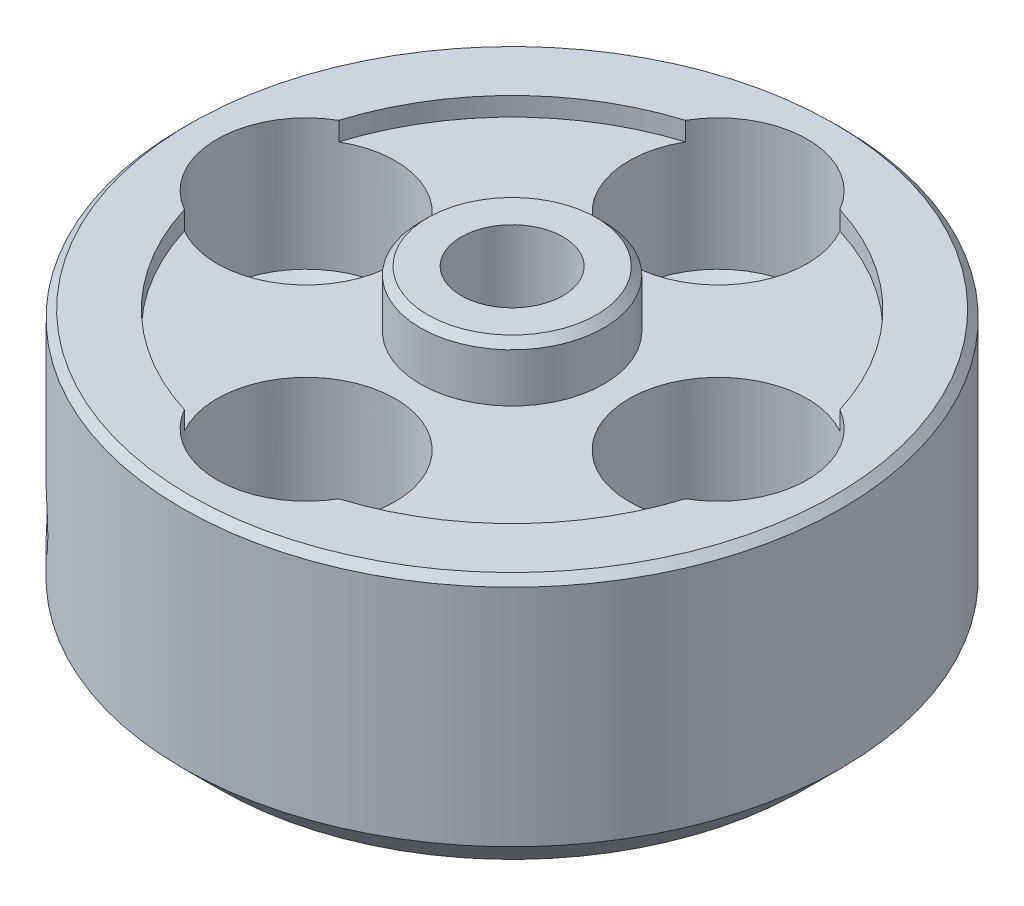
from build123d import *

# Parameters (mm, degrees)
SKETCH2_R                              = 11.176
BOSS_EXTRUDE1_DEPTH                    = 9.144
SKETCH3_R                              = 8.89
SKETCH3_R_2                            = 3.1115
CUT_EXTRUDE1_DEPTH                     = 0.635
CHAMFER1_SIZE                          = 0.254
CHAMFER2_SIZE                          = 1.27
BOSS_EXTRUDE2_START                    = 1.27
SKETCH10_R                             = 3.1115
SKETCH10_R_2                           = 1.5875
BOSS_EXTRUDE2_DEPTH                    = 1.27
CHAMFER3_SIZE                          = 0.254
F_2_56_TAPPED_HOLE3_D                  = 1.778
F_2_56_TAPPED_HOLE3_DEPTH              = 11.43
F_2_56_TAPPED_HOLE3_CSINK_D            = 2.54
F_2_56_TAPPED_HOLE3_CSINK_ANGLE        = 90
F_2_56_TAPPED_HOLE3_TIP                = 0.53416509
F_29_0_136_DIAMETER_HOLE1_D            = 3.4544
B_0_238_DIAMETER_HOLE1_D               = 6.0452
B_0_238_DIAMETER_HOLE1_DEPTH           = 4.445
B_0_238_DIAMETER_HOLE1_TIP             = 1.816161307
F_1_16_0_0625_DIAMETER_HOLE1_OUTLINE_R = 0.79375
F_1_16_0_0625_DIAMETER_HOLE1_DEPTH     = 3.359771909


# Read off the part's stored shape, not the designer's step: 1/16 (0.0625) Diameter Hole1
with BuildPart() as part:
    # Sketch2 → Boss-Extrude1 (new body)
    with BuildSketch(Plane(origin=(0, 0, 0), x_dir=(1, 0, 0), z_dir=(0, 1, 0))):
        with Locations(Location((0, 0, 0), (0, 0, 270))):
            Circle(SKETCH2_R)
    extrude(amount=BOSS_EXTRUDE1_DEPTH)

    # Sketch3 → Cut-Extrude1 (cut)
    with BuildSketch(Plane(origin=(0, 9.144, 0), x_dir=(1, 0, 0), z_dir=(0, 1, 0))):
        with Locations(Location((0, 0, 0), (0, 0, 270))):
            Circle(SKETCH3_R)
        with Locations(Location((0, 0, 0), (0, 0, 270))):
            Circle(SKETCH3_R_2, mode=Mode.SUBTRACT)
    extrude(amount=-CUT_EXTRUDE1_DEPTH, mode=Mode.SUBTRACT)

    # Chamfer1
    chamfer1_edges = [part.edges().sort_by_distance(p)[0] for p in [
        (0, 9.144, -11.176),
    ]]
    chamfer(chamfer1_edges, length=CHAMFER1_SIZE)

    # Chamfer2
    chamfer2_edges = [part.edges().sort_by_distance(p)[0] for p in [
        (0, 0, -11.176),
    ]]
    chamfer(chamfer2_edges, length=CHAMFER2_SIZE)

    # Sketch10 → Boss-Extrude2 (add)
    with BuildSketch(Plane(origin=(0, 9.144, 0), x_dir=(1, 0, 0), z_dir=(0, 1, 0)).offset(BOSS_EXTRUDE2_START)):
        with Locations(Location((0, 0, 0), (0, 0, 270))):
            Circle(SKETCH10_R)
        with Locations(Location((0, 0, 0), (0, 0, 270))):
            Circle(SKETCH10_R_2, mode=Mode.SUBTRACT)
    extrude(amount=-BOSS_EXTRUDE2_DEPTH)

    # Chamfer3
    chamfer3_edges = [part.edges().sort_by_distance(p)[0] for p in [
        (0, 10.414, -3.1115),
    ]]
    chamfer(chamfer3_edges, length=CHAMFER3_SIZE)

    # #2-56 Tapped Hole3
    with Locations(Plane(origin=(-8.082230509, 0, 8.082230509), x_dir=(0, -1, 0), z_dir=(-0.7071067811865488, 0, 0.7071067811865464))):
        with Locations((-3.175, 0)):
            CounterSinkHole(F_2_56_TAPPED_HOLE3_D / 2, F_2_56_TAPPED_HOLE3_CSINK_D / 2, depth=F_2_56_TAPPED_HOLE3_DEPTH, counter_sink_angle=F_2_56_TAPPED_HOLE3_CSINK_ANGLE)
            with Locations((0, 0, -(F_2_56_TAPPED_HOLE3_DEPTH + F_2_56_TAPPED_HOLE3_TIP / 2))):  # 118° drill point
                Cone(0, F_2_56_TAPPED_HOLE3_D / 2, F_2_56_TAPPED_HOLE3_TIP, mode=Mode.SUBTRACT)

    # #29 (0.136) Diameter Hole1 (through all)
    with Locations(Plane(origin=(0, 0, 0), x_dir=(-1, 0, 0), z_dir=(0, -1, 0))):
        with Locations((0, 0)):
            Hole(F_29_0_136_DIAMETER_HOLE1_D / 2)

    # B (0.238) Diameter Hole1
    with Locations(Plane(origin=(0, 9.144, 0), x_dir=(1, 0, 0), z_dir=(0, 1, 0))):
        with Locations((-6.985, 0), (0, 6.985), (0, -6.985), (6.985, 0)):
            Hole(B_0_238_DIAMETER_HOLE1_D / 2, depth=B_0_238_DIAMETER_HOLE1_DEPTH)
            with Locations((0, 0, -(B_0_238_DIAMETER_HOLE1_DEPTH + B_0_238_DIAMETER_HOLE1_TIP / 2))):  # 118° drill point
                Cone(0, B_0_238_DIAMETER_HOLE1_D / 2, B_0_238_DIAMETER_HOLE1_TIP, mode=Mode.SUBTRACT)

    # 1/16 (0.0625) Diameter Hole1 outline → 1/16 (0.0625) Diameter Hole1 (cut)
    with BuildSketch(Plane(origin=(0, 0, 0), x_dir=(1, 0, 0), z_dir=(0, 1, 0))):
        with Locations((-6.985, 0)):
            Circle(F_1_16_0_0625_DIAMETER_HOLE1_OUTLINE_R)
        with Locations((0, -6.985)):
            Circle(F_1_16_0_0625_DIAMETER_HOLE1_OUTLINE_R)
        with Locations((6.985, 0)):
            Circle(F_1_16_0_0625_DIAMETER_HOLE1_OUTLINE_R)
        with Locations((0, 6.985)):
            Circle(F_1_16_0_0625_DIAMETER_HOLE1_OUTLINE_R)
    extrude(amount=F_1_16_0_0625_DIAMETER_HOLE1_DEPTH, mode=Mode.SUBTRACT)


solid = part.part
